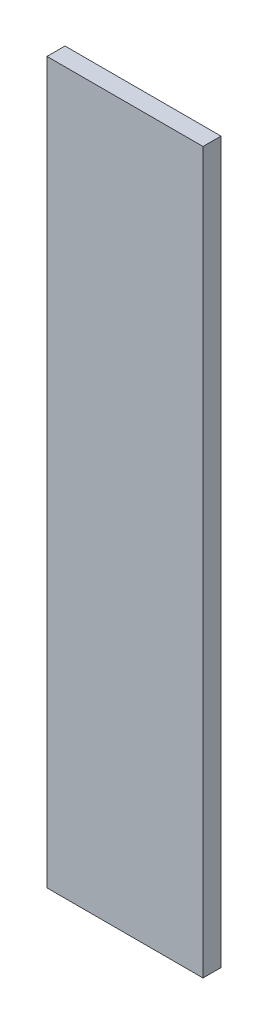
from build123d import *

# Parameters (mm, degrees)
SKETCH1_W           = 165.1
SKETCH1_H           = 762
BOSS_EXTRUDE1_DEPTH = 19.05


with BuildPart() as part:
    # Sketch1 → Boss-Extrude1 (new body)
    with BuildSketch(Plane.XY):
        with Locations((33.292567916, -291.059577714)):
            Rectangle(SKETCH1_W, SKETCH1_H)
    extrude(amount=BOSS_EXTRUDE1_DEPTH)


solid = part.part
